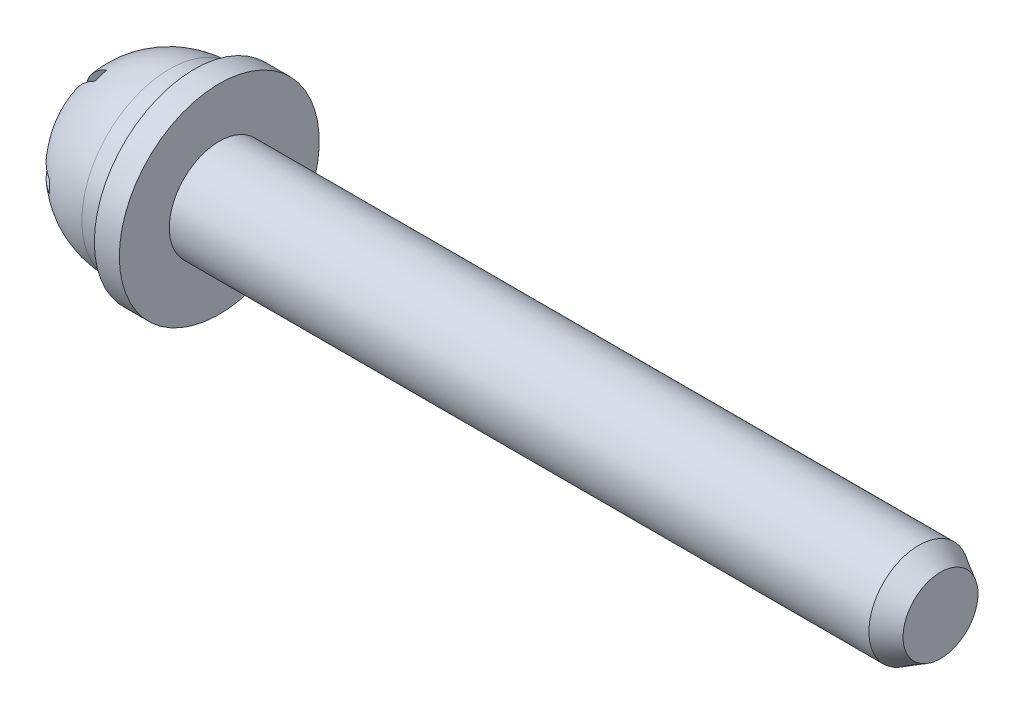
from build123d import *

# Parameters (mm, degrees)
SKETCH2_R               = 2
BOSS_EXTRUDE1_DEPTH     = 28.866025404
CUT_EXTRUDE1_REACH      = 33.38
CUT_EXTRUDE1_END_RADIUS = 3.5
CHAMFER1_SIZE           = 0.5
CHAMFER1_SIZE2          = 0.866025404
FILLET1_R               = 0.5


with BuildPart() as part:
    # Sketch1 → Revolve1 (revolve)
    with BuildSketch(Plane(origin=(0, 0, 0), x_dir=(-1, 0, 0), z_dir=(0, 0, -1)), mode=Mode.PRIVATE) as revolve1_sk:
        with BuildLine():
            Line((14, 4), (14, 0))
            Line((14, 0), (19.5, 0))
            ThreePointArc((19.5, 0), (18.474873734, 2.474873734), (16, 3.5))
            Line((16, 3.5), (15, 3.5))
            Line((15, 3.5), (15, 4))
            Line((15, 4), (14, 4))
        make_face()
    revolve(revolve1_sk.sketch.rotate(Axis((-14, 0, 0), (-1, 0, 0)), 270), axis=Axis((-14, 0, 0), (-1, 0, 0)))

    # Sketch2 → Boss-Extrude1 (add)
    with BuildSketch(Plane(origin=(-14, 0, 0), x_dir=(0, 0, -1), z_dir=(1, 0, 0))):
        Circle(SKETCH2_R)
    extrude(amount=BOSS_EXTRUDE1_DEPTH)

    # Cut-Extrude1: up to this sphere (the profile starts inside it)
    cut_extrude1_end = Location((-16, 0, 0)) * Sphere(CUT_EXTRUDE1_END_RADIUS, mode=Mode.PRIVATE)
    # Sketch3 → Cut-Extrude1 (cut, up to the surface)
    with BuildSketch(Plane(origin=(-16, 0, 0), x_dir=(0, 0, -1), z_dir=(1, 0, 0)), mode=Mode.PRIVATE) as cut_extrude1_sk1:
        with BuildLine():
            Line((2.271345978, 1.959843731), (0.191997374, 0.590907157))
            Line((0.191997374, 0.590907157), (-0.685590254, 2.920610553))
            ThreePointArc((-0.685590254, 2.920610553), (-0.927050983, 2.853169549), (-1.162037644, 2.765803412))
            Line((-1.162037644, 2.765803412), (-0.502655651, 0.365200707))
            Line((-0.502655651, 0.365200707), (-2.989524738, 0.250483216))
            ThreePointArc((-2.989524738, 0.250483216), (-3, 0), (-2.989524738, -0.250483216))
            Line((-2.989524738, -0.250483216), (-0.502655651, -0.365200707))
            Line((-0.502655651, -0.365200707), (-1.162037644, -2.765803412))
            ThreePointArc((-1.162037644, -2.765803412), (-0.927050983, -2.853169549), (-0.685590254, -2.920610553))
            Line((-0.685590254, -2.920610553), (0.191997374, -0.590907157))
            Line((0.191997374, -0.590907157), (2.271345978, -1.959843731))
            ThreePointArc((2.271345978, -1.959843731), (2.427050983, -1.763355757), (2.565806659, -1.554553373))
            Line((2.565806659, -1.554553373), (0.621316554, 0))
            Line((0.621316554, 0), (2.565806659, 1.554553373))
            ThreePointArc((2.565806659, 1.554553373), (2.427050983, 1.763355757), (2.271345978, 1.959843731))
        make_face()
    cut_extrude1_tool1 = extrude(cut_extrude1_sk1.sketch, amount=-CUT_EXTRUDE1_REACH, mode=Mode.PRIVATE) & cut_extrude1_end
    add(cut_extrude1_tool1.solids().sort_by_distance((-16, 0, 0))[0], mode=Mode.SUBTRACT)

    # Chamfer1
    chamfer1_edges = [part.edges().sort_by_distance(p)[0] for p in [
        (14.866025404, 0, 2),
    ]]
    chamfer1_side = [part.faces().sort_by_distance(p)[0] for p in [
        (14.866025404, 0, 0),
    ]]
    chamfer(chamfer1_edges, length=CHAMFER1_SIZE, length2=CHAMFER1_SIZE2, reference=chamfer1_side[0])

    # Fillet1
    # the kernel refuses this fillet: 0.5 mm, written as the material it takes off along each edge
    with BuildSketch(Plane(origin=(-16, 0, -0.621316554), x_dir=(0, -0.6244406033134772, -0.7810722968672622), z_dir=(-1, 0, 0)), Plane(origin=(-16, -0.590907157, -0.191997374), x_dir=(0, -0.9358066560348443, 0.35251369125309573), z_dir=(-1, 0, 0)), Plane(origin=(-16, -0.365200707, 0.502655651), x_dir=(0, 0.04608028298555685, 0.9989377395613659), z_dir=(-1, 0, 0)), Plane(origin=(-16, 0.365200707, 0.502655651), x_dir=(0, 0.964285837131132, 0.2648637844408172), z_dir=(-1, 0, 0)), Plane(origin=(-16, 0.590907157, -0.191997374), x_dir=(0, 0.5498811392316572, -0.8352429183879951), z_dir=(-1, 0, 0))) as fillet1_piece_1:
        with BuildLine():
            CenterArc((FILLET1_R * 1.25083521591, -FILLET1_R), FILLET1_R, 90, 102.717718013)
            Line((FILLET1_R * 0.275368703333, -FILLET1_R * 1.22014786587), (0, 0))
            Line((0, 0), (FILLET1_R * 1.25083521591, 0))
        make_face()
    extrude(amount=5.007954817, mode=Mode.SUBTRACT)


solid = part.part
